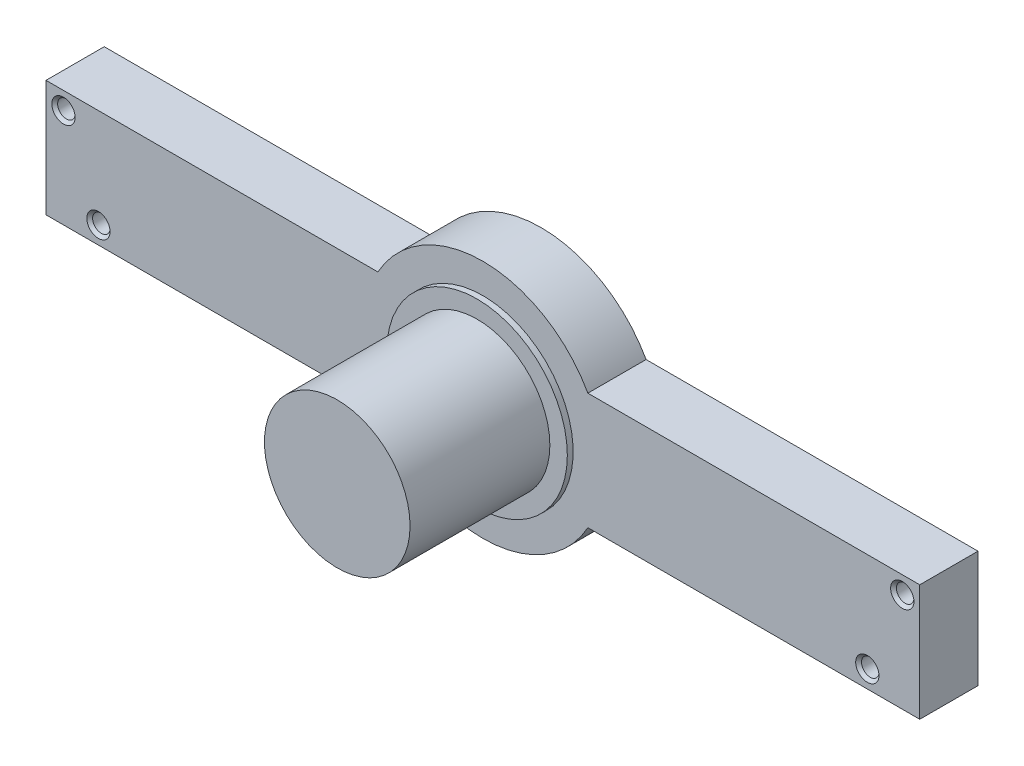
from build123d import *

# Parameters (mm, degrees)
SZKIC1_W                    = 150
SZKIC1_H                    = 20
DODANIE_WYCI_GNI_CIE1_DEPTH = 10
SZKIC2_R                    = 20.61119484
DODANIE_WYCI_GNI_CIE2_DEPTH = 10
SZKIC3_R                    = 12.5
DODANIE_WYCI_GNI_CIE5_DEPTH = 25
SZKIC8_R                    = 15.5
DODANIE_WYCI_GNI_CIE6_DEPTH = 1
SZKIC9_R                    = 1.5
WYTNIJ_WYCI_GNI_CIE1_DEPTH  = 10
SFAZOWANIE1_SIZE            = 0.5


with BuildPart() as part:
    # Szkic1 → Dodanie-wyciągnięcie1 (new body)
    with BuildSketch(Plane.XY):
        Rectangle(SZKIC1_W, SZKIC1_H)
    extrude(amount=DODANIE_WYCI_GNI_CIE1_DEPTH)

    # Szkic2 → Dodanie-wyciągnięcie2 (add)
    with BuildSketch(Plane.XY.offset(10)):
        Circle(SZKIC2_R)
    extrude(amount=-DODANIE_WYCI_GNI_CIE2_DEPTH)

    # Szkic3 → Dodanie-wyciągnięcie5 (add)
    with BuildSketch(Plane.XY.offset(10)):
        Circle(SZKIC3_R)
    extrude(amount=DODANIE_WYCI_GNI_CIE5_DEPTH)

    # Szkic8 → Dodanie-wyciągnięcie6 (add)
    with BuildSketch(Plane.XY.offset(10)):
        Circle(SZKIC8_R)
    extrude(amount=DODANIE_WYCI_GNI_CIE6_DEPTH)

    # Szkic9 → Wytnij-wyciągnięcie1 (cut)
    with BuildSketch(Plane(origin=(0, 0, 0), x_dir=(-1, 0, 0), z_dir=(0, 0, -1))):
        with Locations((-72, 7)):
            Circle(SZKIC9_R)
        with Locations((-66, -7)):
            Circle(SZKIC9_R)
        with Locations((66, -7)):
            Circle(SZKIC9_R)
        with Locations((72, 7)):
            Circle(SZKIC9_R)
    extrude(amount=-WYTNIJ_WYCI_GNI_CIE1_DEPTH, mode=Mode.SUBTRACT)

    # Sfazowanie1
    sfazowanie1_edges = [part.edges().sort_by_distance(p)[0] for p in [
        (-64.5, -7, 10),
        (-70.5, 7, 10),
        (67.5, -7, 10),
        (73.5, 7, 10),
    ]]
    chamfer(sfazowanie1_edges, length=SFAZOWANIE1_SIZE)


solid = part.part
